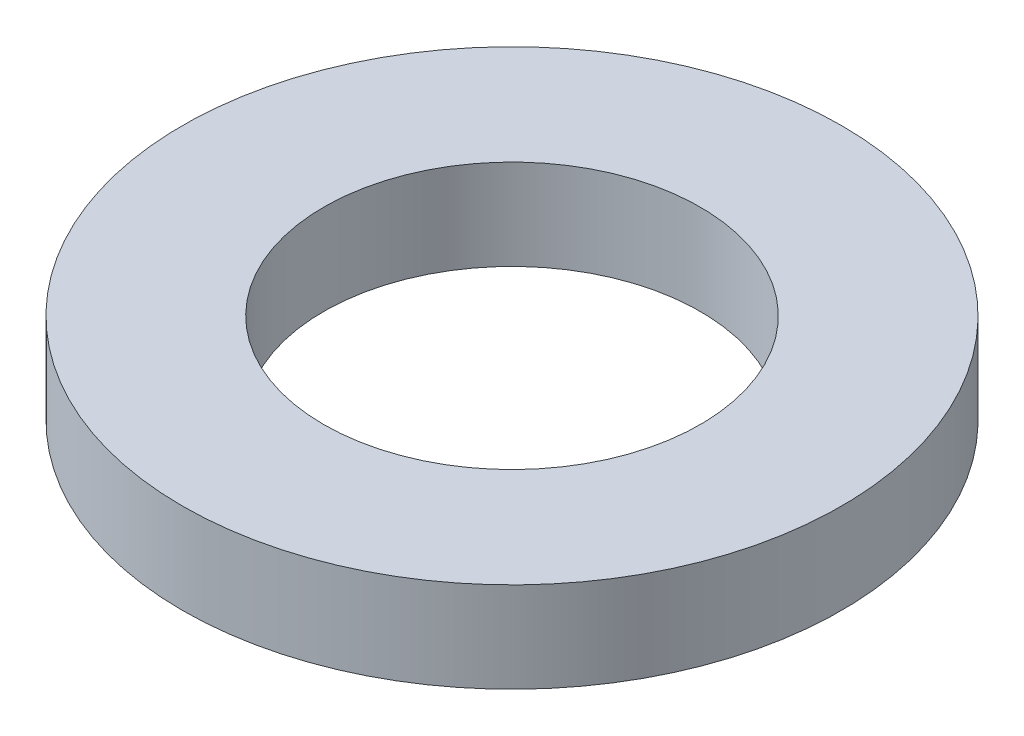
from build123d import *

# Parameters (mm, degrees)
SKETCH1_R           = 87.5
BOSS_EXTRUDE1_DEPTH = 24
SKETCH2_R           = 50
CUT_EXTRUDE1_DEPTH  = 127.049593415


with BuildPart() as part:
    # Sketch1 → Boss-Extrude1 (new body)
    with BuildSketch(Plane(origin=(0, 0, 0), x_dir=(1, 0, 0), z_dir=(0, 1, 0))):
        Circle(SKETCH1_R)
    extrude(amount=BOSS_EXTRUDE1_DEPTH)

    # Sketch2 → Cut-Extrude1 (cut, through all)
    with BuildSketch(Plane(origin=(0, 0, 0), x_dir=(1, 0, 0), z_dir=(0, 1, 0))):
        Circle(SKETCH2_R)
    extrude(amount=CUT_EXTRUDE1_DEPTH, mode=Mode.SUBTRACT)


solid = part.part
